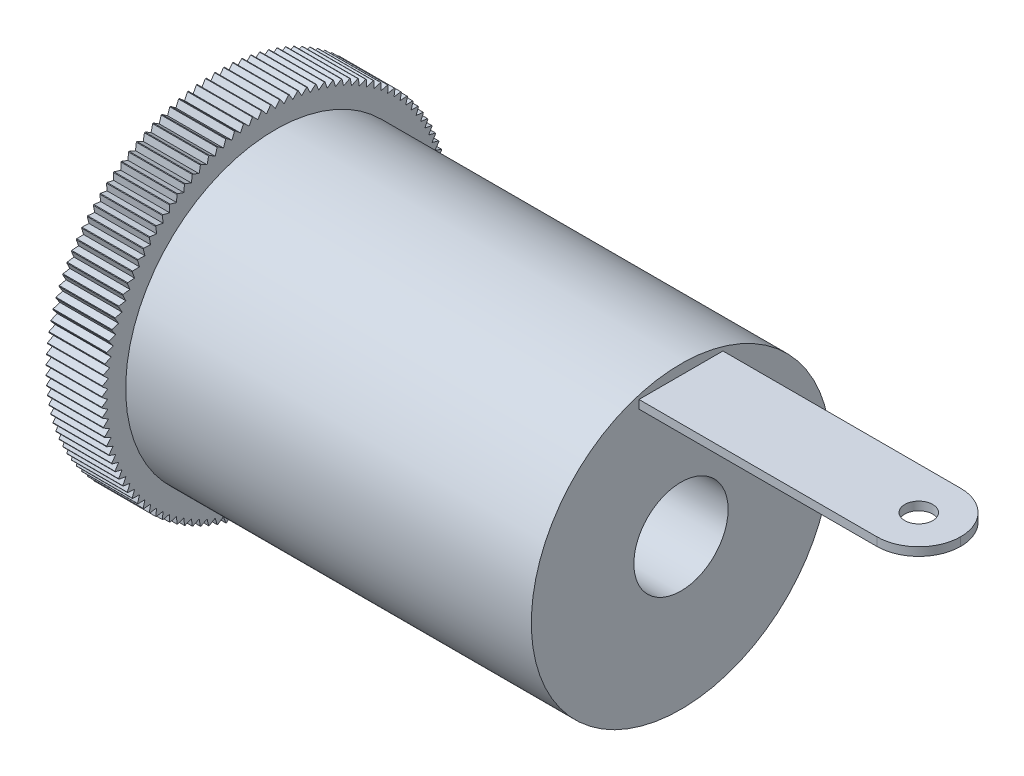
from build123d import *

# Parameters (mm, degrees)
CUT_EXTRUDE_START        = -10
CUT_EXTRUDE_1_DEPTH      = 10
PATTERN_CIRCULAR_1_COUNT = 120
SKETCH_3_W               = 3
SKETCH_3_H               = 0.3
EXTRUDE_1_DEPTH          = 10
FILLET_2_R               = 1.5
SKETCH_4_R               = 0.5
CUT_EXTRUDE_2_DEPTH      = 11


with BuildPart() as part:
    # 草图1 → 旋转1 (revolve)
    with BuildSketch(Plane.XY, mode=Mode.PRIVATE) as revolve_1_sk:
        Polygon((-12.81232821, 6.2), (-10.81232821, 6.2), (-10.81232821, 5.35), (3.68767179, 5.35), (3.68767179, 1.684775806), (-12.81232821, 1.684775806), align=None)
    revolve(revolve_1_sk.sketch.rotate(Axis((0, 0, 0), (-1, 0, 0)), 90), axis=Axis((0, 0, 0), (-1, 0, 0)))

    # 草图2 → 切除-拉伸1 (cut)
    with BuildSketch(Plane.ZY.offset(12.81232821).offset(CUT_EXTRUDE_START)):
        with BuildLine():
            Line((-0.15, 6.198185218), (0, 6))
            Line((0, 6), (0.15, 6.198185218))
            ThreePointArc((0.15, 6.198185218), (0, 6.2), (-0.15, 6.198185218))
        make_face()
    cut_extrude_1 = extrude(amount=CUT_EXTRUDE_1_DEPTH, mode=Mode.SUBTRACT)

    # 阵列(圆周)1: 切除-拉伸1 ×120 about axis
    pattern_circular_1_axis = Axis((0, 0, 0), (1, 0, 0))
    for i in range(1, PATTERN_CIRCULAR_1_COUNT):
        add(cut_extrude_1.rotate(pattern_circular_1_axis, i * 360 / PATTERN_CIRCULAR_1_COUNT), mode=Mode.SUBTRACT)

    # 草图3 → 凸台-拉伸1 (add)
    with BuildSketch(Plane(origin=(3.68767179, 0, 0), x_dir=(0, 0, -1), z_dir=(1, 0, 0))):
        with Locations((0, 4.845171795)):
            Rectangle(SKETCH_3_W, SKETCH_3_H)
    extrude(amount=EXTRUDE_1_DEPTH)

    # 圆角2
    fillet_2_edges = [part.edges().sort_by_distance(p)[0] for p in [
        (13.68767179, 4.845171795, -1.5),
        (13.68767179, 4.845171795, 1.5),
    ]]
    fillet(fillet_2_edges, radius=FILLET_2_R - 0.0001)  # a hair under: the kernel refuses the full size

    # 草图4 → 切除-拉伸2 (cut)
    with BuildSketch(Plane(origin=(0, 4.995171795, 0), x_dir=(1, 0, 0), z_dir=(0, 1, 0))):
        with Locations(Location((12.18767179, 0, 0), (0, 0, 270))):
            Circle(SKETCH_4_R)
    extrude(amount=-CUT_EXTRUDE_2_DEPTH, mode=Mode.SUBTRACT)


solid = part.part
